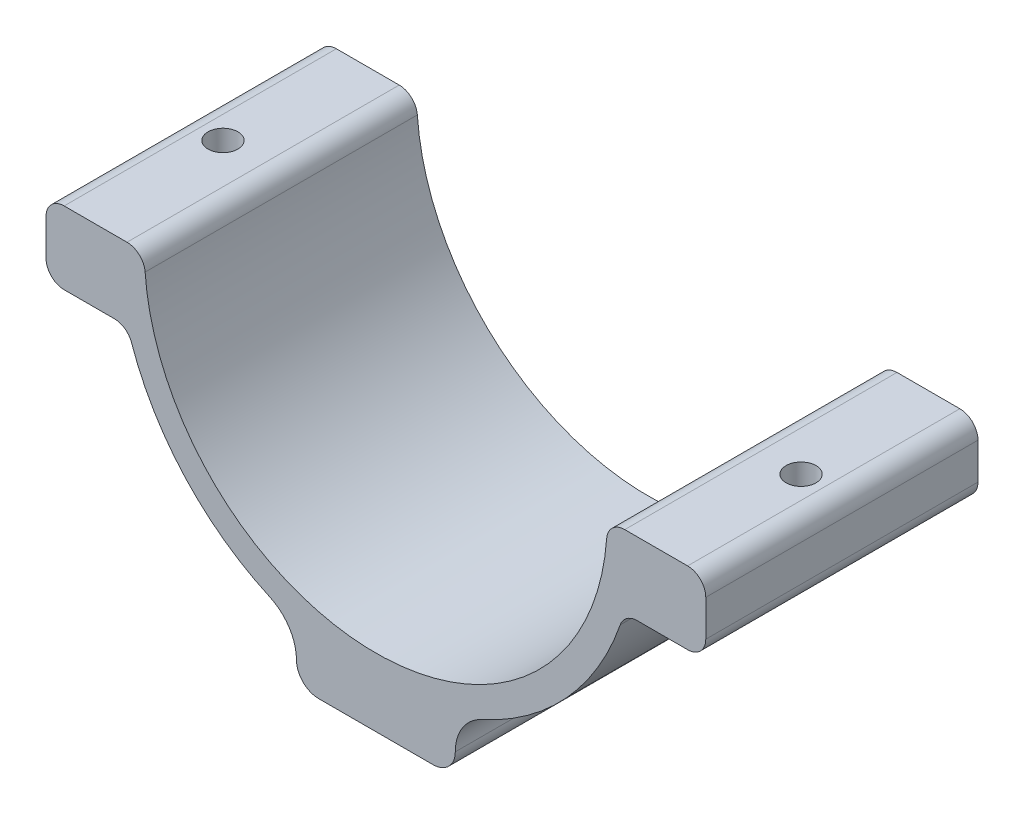
from build123d import *

# Parameters (mm, degrees)
SKETCH3_R           = 8.05
BOSS_EXTRUDE1_DEPTH = 30
SKETCH4_R           = 8.05
SKETCH4_R_2         = 4.3
BOSS_EXTRUDE2_DEPTH = 25
CHAMFER1_SIZE       = 3
FILLET1_R           = 11
SKETCH5_R           = 1.65
CUT_EXTRUDE1_DEPTH  = 81.777378375
SKETCH6_R           = 3
CUT_EXTRUDE2_DEPTH  = 3
SKETCH7_W           = 22
SKETCH7_H           = 18.6
CUT_EXTRUDE3_DEPTH  = 88.398998033
FILLET2_R           = 2
SKETCH8_R           = 1.65
CUT_EXTRUDE4_DEPTH  = 73.43358938
CUT_EXTRUDE5_DEPTH  = 73.43358938
FILLET3_R           = 5
SKETCH10_R          = 3
CUT_EXTRUDE6_DEPTH  = 3
CUT_EXTRUDE7_DEPTH  = 73.43358938
SKETCH12_R          = 2.1
CUT_EXTRUDE8_DEPTH  = 5


# Some blends are built 0.0001 mm under size
with BuildPart() as part:
    # Sketch3 → Boss-Extrude1 (new body)
    with BuildSketch(Plane.XY):
        with BuildLine():
            Line((-25.5, 0), (-36.354158733, 0))
            Line((-36.354158733, 0), (-36.354158733, -8))
            Line((-36.354158733, -8), (-27.354158733, -8))
            ThreePointArc((-27.354158733, -8), (-21.246325292, -18.995885385), (-11, -26.29163365))
            Line((-11, -26.29163365), (-11, -73.6))
            Line((-11, -73.6), (11, -73.6))
            Line((11, -73.6), (11, -26.29163365))
            ThreePointArc((11, -26.29163365), (21.246325292, -18.995885385), (27.354158733, -8))
            Line((27.354158733, -8), (36.354158733, -8))
            Line((36.354158733, -8), (36.354158733, 0))
            Line((36.354158733, 0), (25.5, 0))
            ThreePointArc((25.5, 0), (0, -25.5), (-25.5, 0))
        make_face()
        with Locations((0, -62.6)):
            Circle(SKETCH3_R, mode=Mode.SUBTRACT)
    extrude(amount=BOSS_EXTRUDE1_DEPTH)

    # Sketch4 → Boss-Extrude2 (add)
    with BuildSketch(Plane.XY):
        with Locations(Location((0, -62.6, 0), (0, 0, 180))):
            Circle(SKETCH4_R)
        with Locations(Location((0, -62.6, 0), (0, 0, 180))):
            Circle(SKETCH4_R_2, mode=Mode.SUBTRACT)
    extrude(amount=BOSS_EXTRUDE2_DEPTH)

    # Chamfer1
    chamfer1_edges = [part.edges().sort_by_distance(p)[0] for p in [
        (0, -73.6, 0),
    ]]
    chamfer(chamfer1_edges, length=CHAMFER1_SIZE)

    # Fillet1
    fillet1_edges = [part.edges().sort_by_distance(p)[0] for p in [
        (-11, -73.6, 16.5),
        (11, -73.6, 16.5),
    ]]
    fillet(fillet1_edges, radius=FILLET1_R - 0.0001)  # a hair under: the kernel refuses the full size

    # Sketch5 → Cut-Extrude1 (cut, through all)
    with BuildSketch(Plane.XZ.offset(8)):
        with Locations((31.854158733, 15)):
            Circle(SKETCH5_R)
    cut_extrude1 = extrude(amount=-CUT_EXTRUDE1_DEPTH, mode=Mode.SUBTRACT)

    # Sketch6 → Cut-Extrude2 (cut)
    with BuildSketch(Plane.XZ.offset(8)):
        with Locations((31.854158733, 15)):
            Circle(SKETCH6_R)
    cut_extrude2 = extrude(amount=-CUT_EXTRUDE2_DEPTH, mode=Mode.SUBTRACT)

    # Mirror1: Cut-Extrude1, Cut-Extrude2 across plane
    add(cut_extrude1.mirror(Plane(origin=(0, 0, 0), x_dir=(0, 0, 1), z_dir=(1, 0, 0))), mode=Mode.SUBTRACT)
    add(cut_extrude2.mirror(Plane(origin=(0, 0, 0), x_dir=(0, 0, 1), z_dir=(1, 0, 0))), mode=Mode.SUBTRACT)

    # Sketch7 → Cut-Extrude3 (cut, through all)
    with BuildSketch(Plane.XY.offset(30)):
        with Locations((0, -64.3)):
            Rectangle(SKETCH7_W, SKETCH7_H)
    extrude(amount=-CUT_EXTRUDE3_DEPTH, mode=Mode.SUBTRACT)

    # Fillet2
    # the kernel refuses this fillet: 2 mm, written as the material it adds along each edge
    with BuildSketch(Plane(origin=(27.354158733, -8, 0), x_dir=(1, 0, 0), z_dir=(0, 0, 1))) as fillet2_piece_1:
        with BuildLine():
            CenterArc((1.459900335, -2), FILLET2_R, 90, 70.860525549)
            ThreePointArc((-0.429546161, -1.344262295), (-0.206451392, -0.674790264), (0, 0))
            Line((0, 0), (1.459900335, 0))
        make_face()
    extrude(amount=30)
    with BuildSketch(Plane(origin=(-27.354158733, -8, 0), x_dir=(0.30437860573795156, -0.9525511347791366, 0), z_dir=(0, 0, 1))) as fillet2_piece_2:
        with BuildLine():
            CenterArc((1.460739841, -1.999386932), FILLET2_R, 91.418691197, 70.860525549)
            Line((-0.444362429, -1.390629721), (0, 0))
            ThreePointArc((0, 0), (0.705611618, -0.008736212), (1.411223236, 0))
        make_face()
    extrude(amount=30)
    # the kernel refuses this fillet: 2 mm, written as the material it takes off along each edge
    with BuildSketch(Plane(origin=(-36.354158733, 0, -5), x_dir=(0, -1, 0), z_dir=(0, 0, 1)), Plane(origin=(36.354158733, 0, -5), x_dir=(-1, 0, 0), z_dir=(0, 0, 1)), Plane(origin=(36.354158733, -8, -5), x_dir=(0, 1, 0), z_dir=(0, 0, 1)), Plane(origin=(-36.354158733, -8, -5), x_dir=(1, 0, 0), z_dir=(0, 0, 1))) as fillet2_2_piece_1:
        with BuildLine():
            CenterArc((FILLET2_R, FILLET2_R), FILLET2_R, 180, 90)
            Line((0, FILLET2_R), (0, 0))
            Line((0, 0), (FILLET2_R, 0))
        make_face()
    extrude(amount=40, mode=Mode.SUBTRACT)
    with BuildSketch(Plane(origin=(-25.5, 0, -4.81794076), x_dir=(-1, 0, 0), z_dir=(0, 0, 1))) as fillet2_2_piece_2:
        with BuildLine():
            CenterArc((1.927176304, 2), FILLET2_R, 184.170647912, 85.829352088)
            ThreePointArc((-0.067527427, 1.854545455), (-0.016887449, 0.927887223), (0, 0))
            Line((0, 0), (1.927176304, 0))
        make_face()
    extrude(amount=39.635881519, mode=Mode.SUBTRACT)
    with BuildSketch(Plane(origin=(25.5, 0, -4.81794076), x_dir=(-0.03638773424584517, -0.9993377471087809, 0), z_dir=(0, 0, 1))) as fillet2_2_piece_3:
        with BuildLine():
            CenterArc((1.928549915, 1.998675494), FILLET2_R, 182.085323956, 85.829352088)
            Line((-0.070125579, 1.925900026), (0, 0))
            ThreePointArc((0, 0), (0.927887223, 0.016887449), (1.855774447, 0))
        make_face()
    extrude(amount=39.635881519, mode=Mode.SUBTRACT)

    # Sketch8 → Cut-Extrude4 (cut, through all)
    with BuildSketch(Plane.XY.offset(30)):
        with Locations((4.5, -49)):
            Circle(SKETCH8_R)
        with Locations((-4.5, -49)):
            Circle(SKETCH8_R)
    extrude(amount=-CUT_EXTRUDE4_DEPTH, mode=Mode.SUBTRACT)

    # Sketch9 → Cut-Extrude5 (cut, through all)
    with BuildSketch(Plane.XY.offset(30)):
        with BuildLine():
            Line((-8.75, -55), (-8.75, -27.12355987))
            ThreePointArc((-8.75, -27.12355987), (-9.883756892, -26.73128036), (-11, -26.29163365))
            Line((-11, -26.29163365), (-11, -55))
            Line((-11, -55), (-8.75, -55))
        make_face()
        with BuildLine():
            Line((8.75, -55), (8.75, -27.12355987))
            ThreePointArc((8.75, -27.12355987), (9.883756892, -26.73128036), (11, -26.29163365))
            Line((11, -26.29163365), (11, -55))
            Line((11, -55), (8.75, -55))
        make_face()
    extrude(amount=-CUT_EXTRUDE5_DEPTH, mode=Mode.SUBTRACT)

    # Fillet3
    fillet3_edges = [part.edges().sort_by_distance(p)[0] for p in [
        (-8.75, -55, 15),
        (-8.75, -27.12355987, 15),
        (8.75, -55, 15),
        (8.75, -27.12355987, 15),
    ]]
    fillet(fillet3_edges, radius=FILLET3_R)

    # Sketch10 → Cut-Extrude6 (cut)
    with BuildSketch(Plane.XY.offset(30)):
        with Locations((4.5, -49)):
            Circle(SKETCH10_R)
        with Locations((-4.5, -49)):
            Circle(SKETCH10_R)
    extrude(amount=-CUT_EXTRUDE6_DEPTH, mode=Mode.SUBTRACT)

    # Sketch11 → Cut-Extrude7 (cut, through all)
    with BuildSketch(Plane.XY.offset(30)):
        with BuildLine():
            Line((8.75, -30.548117782), (8.75, -50))
            ThreePointArc((8.75, -50), (7.285533906, -53.535533906), (3.75, -55))
            Line((3.75, -55), (-3.75, -55))
            ThreePointArc((-3.75, -55), (-7.285533906, -53.535533906), (-8.75, -50))
            Line((-8.75, -50), (-8.75, -30.548117782))
            ThreePointArc((-8.75, -30.548117782), (-8.031860325, -32.281860325), (-6.298117782, -33))
            Line((-6.298117782, -33), (6.298117782, -33))
            ThreePointArc((6.298117782, -33), (8.031860325, -32.281860325), (8.75, -30.548117782))
        make_face()
    extrude(amount=-CUT_EXTRUDE7_DEPTH, mode=Mode.SUBTRACT)

    # Sketch12 → Cut-Extrude8 (cut)
    with BuildSketch(Plane.XZ.offset(33)):
        with Locations(Location((-4.5, 15, 0), (0, 0, 270))):
            Circle(SKETCH12_R)
        with Locations(Location((4.5, 15, 0), (0, 0, 270))):
            Circle(SKETCH12_R)
    extrude(amount=-CUT_EXTRUDE8_DEPTH, mode=Mode.SUBTRACT)


solid = part.part
